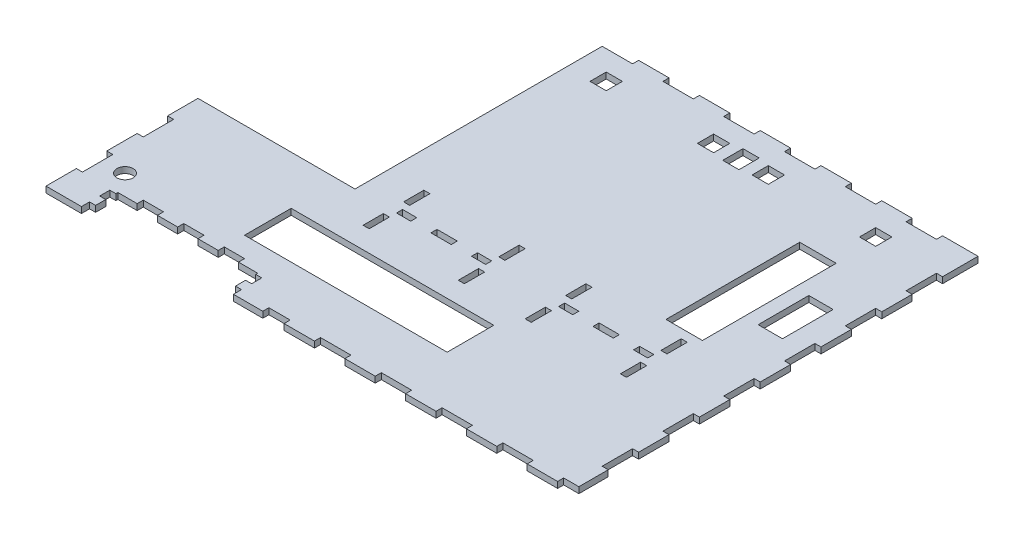
from build123d import *

# Parameters (mm, degrees)
CROQUIS1_W              = 10
CROQUIS1_H              = 3
CROQUIS1_W_2            = 3
CROQUIS1_H_2            = 10
CROQUIS1_W_3            = 7
CROQUIS1_W_4            = 8
CROQUIS1_H_3            = 8
SALIENTE_EXTRUIR1_DEPTH = 3
SKETCH1_W               = 12
SKETCH1_H               = 25
SKETCH1_W_2             = 18
SKETCH1_H_2             = 66
CUT_EXTRUDE2_DEPTH      = 10
SKETCH2_W               = 8
SKETCH2_H               = 10
CUT_EXTRUDE3_DEPTH      = 10
SKETCH3_R               = 4
CUT_EXTRUDE4_DEPTH      = 10


with BuildPart() as part:
    # Croquis1 → Saliente-Extruir1 (new body)
    with BuildSketch(Plane(origin=(0, 0, 0), x_dir=(1, 0, 0), z_dir=(0, 1, 0))):
        Polygon((17.5, 79), (20.5, 79), (20.5, 80), (25.626440042, 80), (30, 80), (30, 83), (40, 83), (40, 80), (50, 80), (50, 83), (60, 83), (60, 80), (70, 80), (70, 83), (80, 83), (80, 80), (84.373559958, 80), (89.5, 80), (89.5, 79), (92.5, 79), (92.5, 74), (89.5, 74), (89.5, 69), (92.5, 69), (92.5, 65), (107, 65), (107, 68), (117.5, 68), (117.5, 65), (132.5, 65), (132.5, 68), (147.5, 68), (147.5, 65), (162.5, 65), (162.5, 68), (177.5, 68), (177.5, 65), (192.5, 65), (192.5, 68), (207.5, 68), (207.5, 65), (222.5, 65), (222.5, 68), (237.5, 68), (237.5, 65), (252.5, 65), (252.5, 68), (260, 68), (260, 82.5), (257, 82.5), (257, 97.5), (260, 97.5), (260, 112.5), (257, 112.5), (257, 127.5), (260, 127.5), (260, 142.5), (257, 142.5), (257, 157.5), (260, 157.5), (260, 172.5), (257, 172.5), (257, 187.5), (260, 187.5), (260, 202.5), (257, 202.5), (257, 217.5), (260, 217.5), (260, 232.5), (257, 232.5), (257, 247.5), (260, 247.5), (260, 265), (242.5, 265), (242.5, 262), (227.5, 262), (227.5, 265), (212.5, 265), (212.5, 262), (197.5, 262), (197.5, 265), (182.5, 265), (182.5, 262), (167.5, 262), (167.5, 265), (152.5, 265), (152.5, 262), (137.5, 262), (137.5, 265), (122.5, 265), (122.5, 262), (107.5, 262), (107.5, 265), (92.5, 265), (92.5, 262), (77.5, 262), (77.5, 155), (77.5, 140), (3, 140), (0, 140), (0, 125), (3, 125), (3, 110), (0, 110), (0, 95), (3, 95), (3, 80), (0, 80), (0, 65), (17.5, 65), (17.5, 69), (20.5, 69), (20.5, 74), (17.5, 74), align=None)
        with Locations((120, 141.5)):
            Rectangle(CROQUIS1_W, CROQUIS1_H, mode=Mode.SUBTRACT)
        Polygon((120, 93), (70, 93), (70, 116), (170, 116), (170, 93), align=None, mode=Mode.SUBTRACT)
        with Locations((200, 141.5)):
            Rectangle(CROQUIS1_W, CROQUIS1_H, mode=Mode.SUBTRACT)
        with Locations((96.5, 151.5)):
            Rectangle(CROQUIS1_W_2, CROQUIS1_H_2, mode=Mode.SUBTRACT)
        with Locations((96.5, 131.5)):
            Rectangle(CROQUIS1_W_2, CROQUIS1_H_2, mode=Mode.SUBTRACT)
        with Locations((101.5, 141.5)):
            Rectangle(CROQUIS1_W_3, CROQUIS1_H, mode=Mode.SUBTRACT)
        with Locations((143.5, 151.5)):
            Rectangle(CROQUIS1_W_2, CROQUIS1_H_2, mode=Mode.SUBTRACT)
        with Locations((143.5, 131.5)):
            Rectangle(CROQUIS1_W_2, CROQUIS1_H_2, mode=Mode.SUBTRACT)
        with Locations((176.5, 151.5)):
            Rectangle(CROQUIS1_W_2, CROQUIS1_H_2, mode=Mode.SUBTRACT)
        with Locations((138.5, 141.5)):
            Rectangle(CROQUIS1_W_3, CROQUIS1_H, mode=Mode.SUBTRACT)
        with Locations((181.5, 141.5)):
            Rectangle(CROQUIS1_W_3, CROQUIS1_H, mode=Mode.SUBTRACT)
        with Locations((223.5, 151.5)):
            Rectangle(CROQUIS1_W_2, CROQUIS1_H_2, mode=Mode.SUBTRACT)
        with Locations((218.5, 141.5)):
            Rectangle(CROQUIS1_W_3, CROQUIS1_H, mode=Mode.SUBTRACT)
        with Locations((176.5, 131.5)):
            Rectangle(CROQUIS1_W_2, CROQUIS1_H_2, mode=Mode.SUBTRACT)
        with Locations((223.5, 131.5)):
            Rectangle(CROQUIS1_W_2, CROQUIS1_H_2, mode=Mode.SUBTRACT)
        with Locations((93.5, 248)):
            Rectangle(CROQUIS1_W_4, CROQUIS1_H_3, mode=Mode.SUBTRACT)
        with Locations((146.5, 248)):
            Rectangle(CROQUIS1_W_4, CROQUIS1_H_3, mode=Mode.SUBTRACT)
        with Locations((173.5, 248)):
            Rectangle(CROQUIS1_W_4, CROQUIS1_H_3, mode=Mode.SUBTRACT)
        with Locations((226.5, 248)):
            Rectangle(CROQUIS1_W_4, CROQUIS1_H_3, mode=Mode.SUBTRACT)
    extrude(amount=SALIENTE_EXTRUIR1_DEPTH)

    # Sketch1 → Cut-Extrude2 (cut)
    with BuildSketch(Plane.XZ):
        with Locations((241, -194)):
            Rectangle(SKETCH1_W, SKETCH1_H)
        with Locations((219, -194)):
            Rectangle(SKETCH1_W_2, SKETCH1_H_2)
    extrude(amount=-CUT_EXTRUDE2_DEPTH, mode=Mode.SUBTRACT)

    # Sketch2 → Cut-Extrude3 (cut)
    with BuildSketch(Plane(origin=(0, 3, 0), x_dir=(1, 0, 0), z_dir=(0, 1, 0))):
        with Locations((160, 248)):
            Rectangle(SKETCH2_W, SKETCH2_H)
    extrude(amount=-CUT_EXTRUDE3_DEPTH, mode=Mode.SUBTRACT)

    # Sketch3 → Cut-Extrude4 (cut)
    with BuildSketch(Plane(origin=(0, 3, 0), x_dir=(1, 0, 0), z_dir=(0, 1, 0))):
        with Locations((14, 90)):
            Circle(SKETCH3_R)
    extrude(amount=-CUT_EXTRUDE4_DEPTH, mode=Mode.SUBTRACT)


solid = part.part
